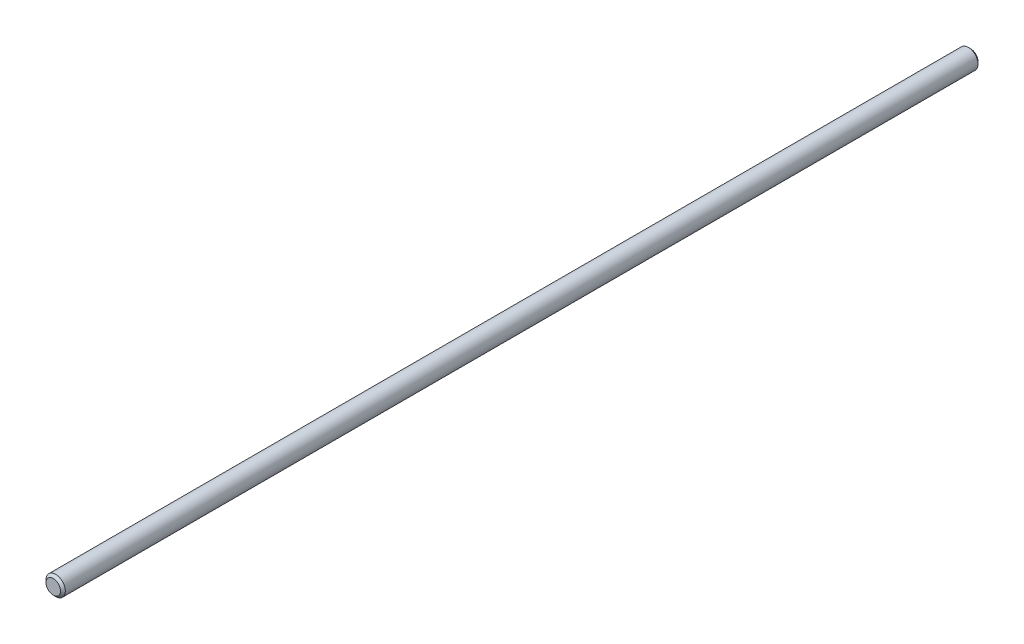
from build123d import *

# Parameters (mm, degrees)
SCHIZZO1_R                   = 4
ESTRUSIONE_ESTRUSIONE1_DEPTH = 380
SMUSSO1_SIZE                 = 1


with BuildPart() as part:
    # Schizzo1 → Estrusione-Estrusione1 (new body)
    with BuildSketch(Plane.XY):
        Circle(SCHIZZO1_R)
    extrude(amount=ESTRUSIONE_ESTRUSIONE1_DEPTH)

    # Smusso1
    smusso1_edges = [part.edges().sort_by_distance(p)[0] for p in [
        (-4, 0, 380),
        (-4, 0, 0),
    ]]
    chamfer(smusso1_edges, length=SMUSSO1_SIZE)


solid = part.part
